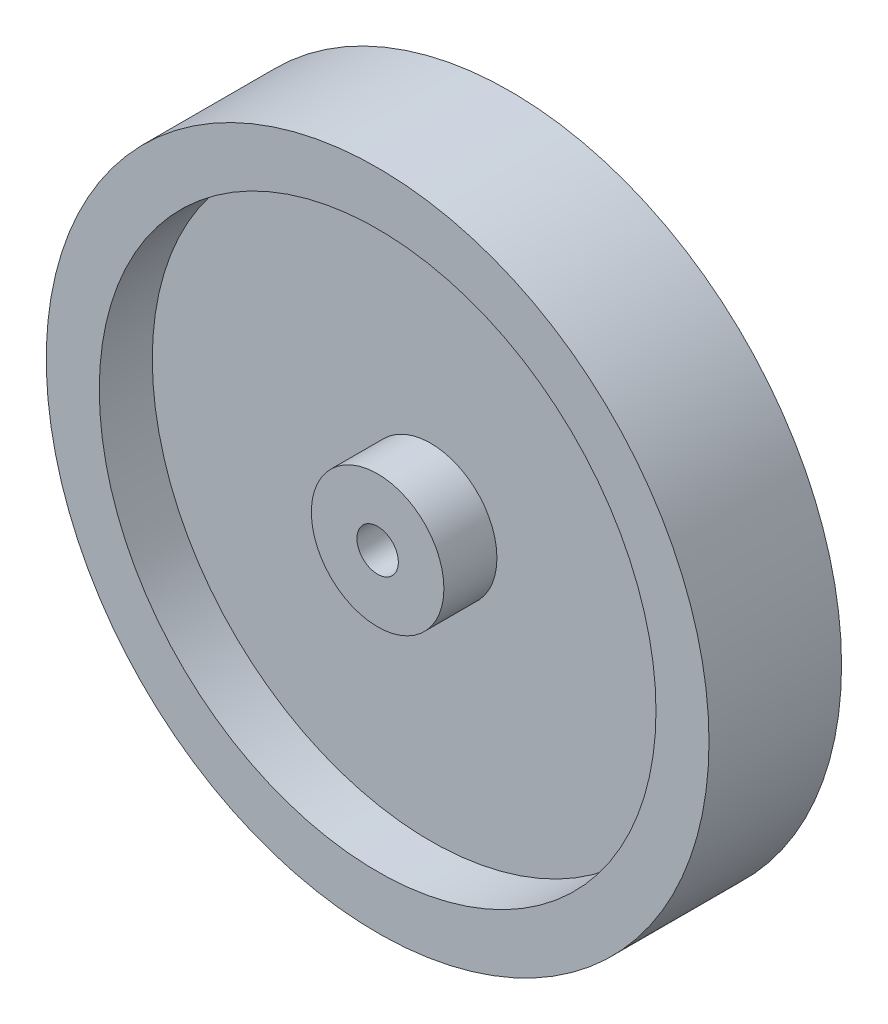
from build123d import *

# Parameters (mm, degrees)
SKETCH1_R           = 63.5
SKETCH1_R_2         = 3.96875
BOSS_EXTRUDE1_DEPTH = 12.7
SKETCH2_R           = 53.34
SKETCH2_R_2         = 12.7
CUT_EXTRUDE1_DEPTH  = 10.16


with BuildPart() as part:
    # Sketch1 → Boss-Extrude1 (new, symmetric)
    with BuildSketch(Plane.XY):
        Circle(SKETCH1_R)
        Circle(SKETCH1_R_2, mode=Mode.SUBTRACT)
    extrude(amount=BOSS_EXTRUDE1_DEPTH, both=True)

    # Sketch2 → Cut-Extrude1 (cut)
    with BuildSketch(Plane.XY.offset(12.7)):
        Circle(SKETCH2_R)
        Circle(SKETCH2_R_2, mode=Mode.SUBTRACT)
    cut_extrude1 = extrude(amount=-CUT_EXTRUDE1_DEPTH, mode=Mode.SUBTRACT)

    # Mirror1: Cut-Extrude1 across plane
    add(cut_extrude1.mirror(Plane.XY), mode=Mode.SUBTRACT)


solid = part.part
